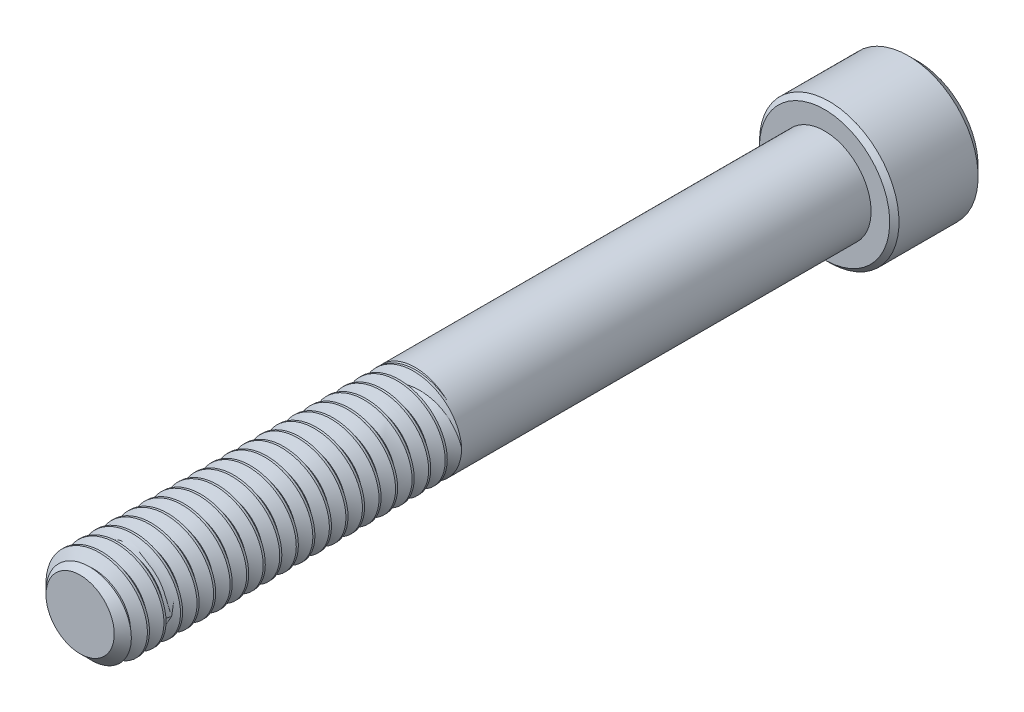
from build123d import *
from build123d.topology import SkipClean

# Parameters (mm, degrees)
SKETCH1_R          = 3.96875
EXTRUDE1_DEPTH     = 63.5
CHAMFER3_SIZE      = 1.058333333
CUT_SWEEP1_PITCH   = 1.411111111
SKETCH6_R          = 5.953125
EXTRUDE2_DEPTH     = 7.9375
CUT_EXTRUDE1_DEPTH = 4.7625
SKETCH8_R          = 3.666174209
CUT_EXTRUDE2_DEPTH = 0.79375
CUT_EXTRUDE2_DRAFT = -45
CHAMFER1_SIZE      = 0.79375
CHAMFER2_SIZE      = 0.396875


with BuildPart() as part:
    # Sketch1 → Extrude1 (new body)
    with BuildSketch(Plane.XY):
        Circle(SKETCH1_R)
    extrude(amount=-EXTRUDE1_DEPTH)

    # Chamfer3
    chamfer3_edges = [part.edges().sort_by_distance(p)[0] for p in [
        (-3.96875, 0, 0),
    ]]
    chamfer(chamfer3_edges, length=CHAMFER3_SIZE)

    # Cut-Sweep1: arcs per turn and ends read off the stored shape
    # Cut-Sweep1: the profile of Sketch3 profile screwed along a right-hand helix through 23 turns, 6 arcs to a turn; built about Z, then put on its axis
    cut_sweep1_z = Axis((0, 0, 0), (0, 0, 1))
    cut_sweep1_corners = [(3.96905, 0, -1.234895427), (3.052206448, 0, -0.705555556), (3.052206448, 0, -0.529166667), (3.96905, 0, 0.000173205)]
    with BuildLine(mode=Mode.PRIVATE) as cut_sweep1_profile:
        Line(cut_sweep1_corners[0], cut_sweep1_corners[1])
        Line(cut_sweep1_corners[1], cut_sweep1_corners[2])
        Line(cut_sweep1_corners[2], cut_sweep1_corners[3])
        Line(cut_sweep1_corners[3], cut_sweep1_corners[0])
    cut_sweep1_cap = Face(cut_sweep1_profile.wire())
    cut_sweep1_turn_angles = [0, 30, 60, 90, 120, 150, 180, 210, 240, 270, 300, 330, 360]
    cut_sweep1_turn_weights = [1, 0.8660254037844387, 1, 0.8660254037844387, 1, 0.8660254037844387, 1, 0.8660254037844387, 1, 0.8660254037844387, 1, 0.8660254037844387, 1]
    cut_sweep1_turn_rails = [Edge.make_bspline([Vector(p[0], p[1], 0).rotate(cut_sweep1_z, cut_sweep1_turn_angles[k]) / cut_sweep1_turn_weights[k] + Vector(0, 0, p[2] + CUT_SWEEP1_PITCH * cut_sweep1_turn_angles[k] / 360) for k in range(13)], [0, 0, 0, 1, 1, 2, 2, 3, 3, 4, 4, 5, 5, 6, 6, 6], 2, cut_sweep1_turn_weights) for p in cut_sweep1_corners]
    cut_sweep1_turn_sides = [Face.make_surface_from_curves(cut_sweep1_turn_rails[p[0]], cut_sweep1_turn_rails[p[1]]) for p in [(0, 1), (1, 2), (2, 3), (3, 0)]]
    cut_sweep1_turn = Solid(Shell([*cut_sweep1_turn_sides, cut_sweep1_cap, cut_sweep1_cap.rotate(cut_sweep1_z, 360).moved(Location((0, 0, CUT_SWEEP1_PITCH * 360 / 360)))]))
    cut_sweep1_each = [*[cut_sweep1_turn.moved(Location((0, 0, CUT_SWEEP1_PITCH * i))) for i in range(23)]]
    add(Plane(origin=(0, 0, 0), x_dir=(0, 1, 0), z_dir=(0, 0, -1)) * Compound([cut_sweep1_each[i] for i in range(0, 23, 2)]), mode=Mode.SUBTRACT)
    add(Plane(origin=(0, 0, 0), x_dir=(0, 1, 0), z_dir=(0, 0, -1)) * Compound([cut_sweep1_each[i] for i in range(1, 23, 2)]), mode=Mode.SUBTRACT)

    # Sketch5 → partially thread (revolve)
    with BuildSketch(Plane(origin=(0, 0, 0), x_dir=(0, 0, -1), z_dir=(1, 0, 0)), mode=Mode.PRIVATE) as partially_thread_sk:
        Polygon((63.5, 3.96875), (28.575, 3.96875), (24.60625, 0), (28.575, 0), (63.5, 0), align=None)
    revolve(partially_thread_sk.sketch.rotate(Axis((0, 0, 0), (0, 0, -1)), 270), axis=Axis((0, 0, 0), (0, 0, -1)))

    # Sketch6 → Extrude2 (add)
    with SkipClean():  # the faces are left unmerged after this step: merging them gives an invalid solid
        with BuildSketch(Plane(origin=(0, 0, -63.5), x_dir=(-1, 0, 0), z_dir=(0, 0, -1))):
            Circle(SKETCH6_R)
        extrude(amount=EXTRUDE2_DEPTH)

    # Sketch7 → Cut-Extrude1 (cut)
    with SkipClean():  # the faces are left unmerged after this step: merging them gives an invalid solid
        with BuildSketch(Plane(origin=(0, 0, -71.4375), x_dir=(-1, 0, 0), z_dir=(0, 0, -1))):
            Polygon((0, 3.666174209), (-3.175, 1.833087105), (-3.175, -1.833087105), (0, -3.666174209), (3.175, -1.833087105), (3.175, 1.833087105), align=None)
        extrude(amount=-CUT_EXTRUDE1_DEPTH, mode=Mode.SUBTRACT)


with BuildPart() as cut_extrude2_tool:
    # Sketch8 → Cut-Extrude2 (with draft: the straight prism first)
    with BuildSketch(Plane(origin=(0, 0, -71.4375), x_dir=(-1, 0, 0), z_dir=(0, 0, -1))):
        Circle(SKETCH8_R)
    extrude(amount=-CUT_EXTRUDE2_DEPTH)
    # Cut-Extrude2: the draft: its side faces are tilted about the plane it starts from
    cut_extrude2_sides = [cut_extrude2_tool.faces().sort_by_distance(p)[0] for p in [
        (3.666174209, 0, -71.040625),
    ]]
    draft(cut_extrude2_sides, Plane(origin=(0, 0, -71.4375), x_dir=(-1, 0, 0), z_dir=(0, 0, -1)), CUT_EXTRUDE2_DRAFT)


with BuildPart() as part_1:
    add(part.part)

    # Cut-Extrude2: cut by cut_extrude2_tool
    add(cut_extrude2_tool.part, mode=Mode.SUBTRACT)

    # Chamfer1
    chamfer1_edges = [part_1.edges().sort_by_distance(p)[0] for p in [
        (5.953125, 0, -71.4375),
    ]]
    chamfer(chamfer1_edges, length=CHAMFER1_SIZE)

    # Chamfer2
    chamfer2_edges = [part_1.edges().sort_by_distance(p)[0] for p in [
        (5.953125, 0, -63.5),
    ]]
    chamfer(chamfer2_edges, length=CHAMFER2_SIZE)


solid = part_1.part
